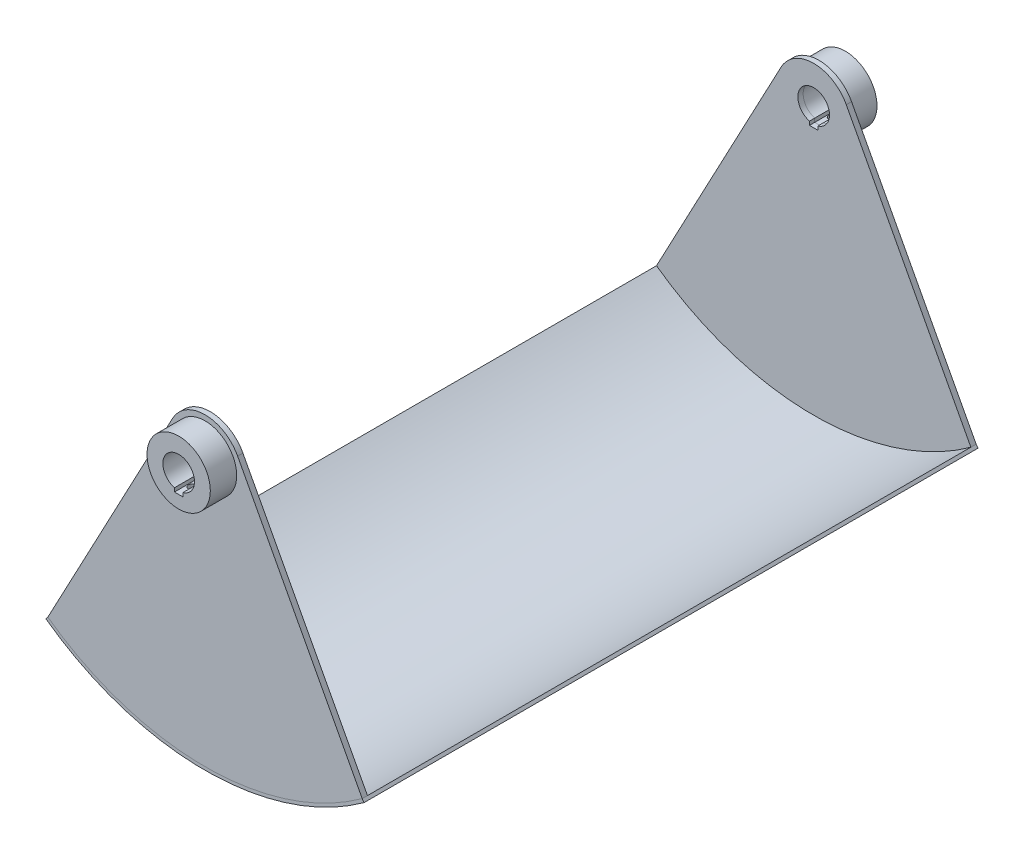
from build123d import *

# Parameters (mm, degrees)
SKETCH1_R           = 15
BOSS_EXTRUDE1_DEPTH = 5
SKETCH2_R           = 30
SKETCH2_R_2         = 15
BOSS_EXTRUDE2_DEPTH = 25
SKETCH3_R           = 3.289745787
CUT_EXTRUDE1_DEPTH  = 43
BASE_FLANGE1_START  = -582
BASE_FLANGE1_DEPTH  = 582
SKETCH6_W           = 8
SKETCH6_H           = 26.362686856
CUT_EXTRUDE2_DEPTH  = 719.613259004


# Sheet-metal steps are written as plain solids
with BuildPart() as part:
    # Sketch1 → Boss-Extrude1 (new body)
    with BuildSketch(Plane.XY):
        with BuildLine():
            Line((-149.011425297, -255.697824808), (-30.90316575, -33.568495302))
            ThreePointArc((-30.90316575, -33.568495302), (0, -15), (30.90316575, -33.568495302))
            Line((30.90316575, -33.568495302), (149.011425297, -255.697824808))
            ThreePointArc((149.011425297, -255.697824808), (0, -304), (-149.011425297, -255.697824808))
        make_face()
        with Locations((0, -50)):
            Circle(SKETCH1_R, mode=Mode.SUBTRACT)
    extrude(amount=BOSS_EXTRUDE1_DEPTH)


with BuildPart() as body_2:
    # Sketch2 → Boss-Extrude2 (new body)
    with BuildSketch(Plane.XY.offset(5)):
        with Locations((0, -50)):
            Circle(SKETCH2_R)
        with Locations((0, -50)):
            Circle(SKETCH2_R_2, mode=Mode.SUBTRACT)
    extrude(amount=BOSS_EXTRUDE2_DEPTH)

    # Sketch3 → Cut-Extrude1 (cut)
    with BuildSketch(Plane(origin=(0, -50, 0), x_dir=(1, 0, 0), z_dir=(0, 1, 0))):
        with Locations(Location((0, -17.5, 0), (0, 0, 270))):
            Circle(SKETCH3_R)
    extrude(amount=-CUT_EXTRUDE1_DEPTH, mode=Mode.SUBTRACT)


with BuildPart() as body_3:
    # Mirror7: mirrored copy
    add(part.part.mirror(Plane(origin=(0, 0, -286), x_dir=(1, 0, 0), z_dir=(0, 0, -1))))


with BuildPart() as body_4:
    # Mirror7 2: mirrored copy
    add(body_2.part.mirror(Plane(origin=(0, 0, -286), x_dir=(1, 0, 0), z_dir=(0, 0, -1))))


with BuildPart() as body_5:
    # Sketch5 → Base-Flange1 (new body)
    with BuildSketch(Plane.XY.offset(5).offset(BASE_FLANGE1_START)):
        with BuildLine():
            ThreePointArc((-149.011425297, -255.697824808), (0, -304), (149.011425297, -255.697824808))
            Line((149.011425297, -255.697824808), (150.771402761, -258.127326676))
            ThreePointArc((150.771402761, -258.127326676), (0, -307), (-150.771402761, -258.127326676))
            Line((-150.771402761, -258.127326676), (-149.011425297, -255.697824808))
        make_face()
    extrude(amount=BASE_FLANGE1_DEPTH)


with BuildPart() as cut_extrude2_tool:
    # Sketch6 → Cut-Extrude2 (new, through all)
    with BuildSketch(Plane(origin=(0, 0, -602), x_dir=(-1, 0, 0), z_dir=(0, 0, -1))):
        with Locations((0, -54.818656572)):
            Rectangle(SKETCH6_W, SKETCH6_H)
    extrude(amount=-CUT_EXTRUDE2_DEPTH)


with BuildPart() as part_1:
    add(part.part)

    # Cut-Extrude2: cut by cut_extrude2_tool
    add(cut_extrude2_tool.part, mode=Mode.SUBTRACT)


with BuildPart() as body_2_1:
    add(body_2.part)

    # Cut-Extrude2: cut by cut_extrude2_tool
    add(cut_extrude2_tool.part, mode=Mode.SUBTRACT)


with BuildPart() as body_3_1:
    add(body_3.part)

    # Cut-Extrude2: cut by cut_extrude2_tool
    add(cut_extrude2_tool.part, mode=Mode.SUBTRACT)


with BuildPart() as body_4_1:
    add(body_4.part)

    # Cut-Extrude2: cut by cut_extrude2_tool
    add(cut_extrude2_tool.part, mode=Mode.SUBTRACT)


solid = Compound([body_5.part, part_1.part, body_2_1.part, body_3_1.part, body_4_1.part])
